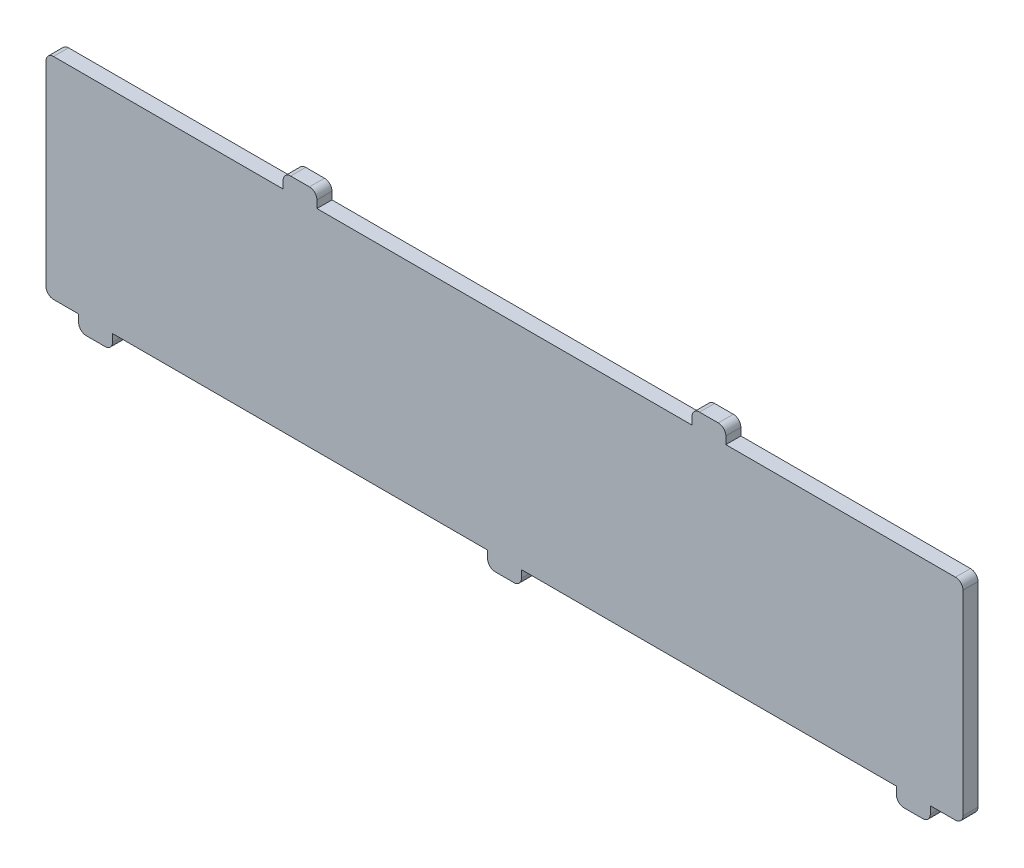
from build123d import *

# Parameters (mm, degrees)
BOSS_EXTRUDE1_DEPTH = 1
FILLET1_R           = 1


with BuildPart() as part:
    # Sketch1 → Boss-Extrude1 (new, symmetric)
    with BuildSketch(Plane.XY):
        Polygon((-29.45, 14), (-61, 14), (-61, -14), (-56.65, -14), (-56.65, -16), (-52.15, -16), (-52.15, -14), (-2.25, -14), (-2.25, -16), (2.25, -16), (2.25, -14), (52.15, -14), (52.15, -16), (56.65, -16), (56.65, -14), (61, -14), (61, 14), (29.45, 14), (29.45, 16), (24.95, 16), (24.95, 14), (-24.95, 14), (-24.95, 16), (-29.45, 16), align=None)
    extrude(amount=BOSS_EXTRUDE1_DEPTH, both=True)

    # Fillet1
    fillet1_edges = [part.edges().sort_by_distance(p)[0] for p in [
        (-61, 14, 0),
        (-61, -14, 0),
        (-52.15, -16, 0),
        (-56.65, -16, 0),
        (2.25, -16, 0),
        (-2.25, -16, 0),
        (52.15, -16, 0),
        (56.65, -16, 0),
        (61, -14, 0),
        (61, 14, 0),
        (29.45, 16, 0),
        (24.95, 16, 0),
        (-24.95, 16, 0),
        (-29.45, 16, 0),
    ]]
    fillet(fillet1_edges, radius=FILLET1_R)


solid = part.part
